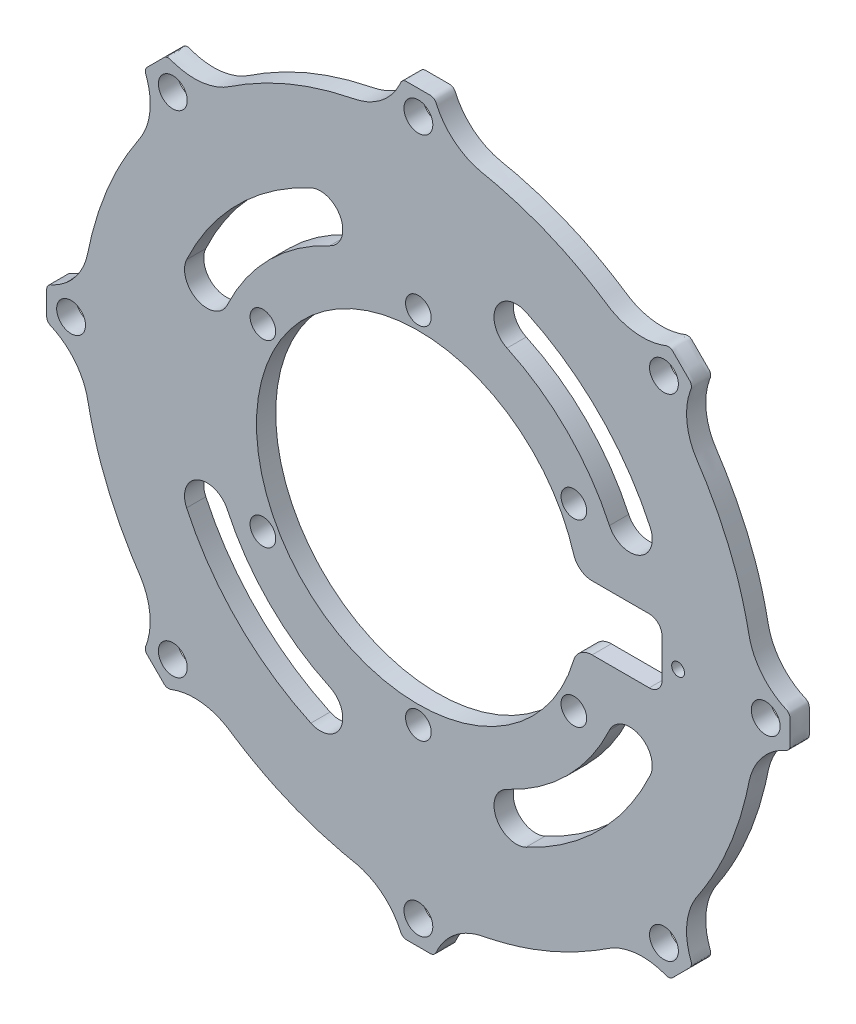
from build123d import *

# Parameters (mm, degrees)
SKETCH1_R                 = 1
BOSS_EXTRUDE1_DEPTH       = 3
F_4_0MM_DOWEL_HOLE1_D     = 4
F_4_0MM_DOWEL_HOLE1_DEPTH = 4
F_4_0MM_DOWEL_HOLE1_TIP   = 1.201721238
M4_CLEARANCE_HOLE1_D      = 4.5
M4_CLEARANCE_HOLE1_DEPTH  = 4
M4_CLEARANCE_HOLE1_TIP    = 1.351936393


with BuildPart() as part:
    # Sketch1 → Boss-Extrude1 (new body)
    with BuildSketch(Plane.XY):
        with BuildLine():
            add(Edge.make_bspline(
                [(-2.792588463, 57.296622314), (-2.798610234, 57.282848917), (-2.831786589, 57.2065726), (-2.866328079, 57.131672052), (-2.895249818, 57.070593275)],
                knots=[0.999327537, 0.999327537, 0.999327537, 0.999327537, 0.999448998, 1, 1, 1, 1], degree=3, weights=[1, 1, 1, 1, 1]))
            add(Edge.make_bspline(
                [(-2.895249818, 57.070593275), (-3.907352197, 54.933170755), (-5.586945631, 53.268270712), (-7.733178428, 52.274987752), (-8.218210626, 52.050513399), (-9.224266632, 51.679333443), (-10.81473369, 51.382377685), (-11.857368808, 51.146245707), (-12.376762361, 51.020248465), (-17.660128133, 49.738581586), (-22.682891966, 47.658084686), (-27.325071073, 44.828456262), (-27.781431281, 44.550283063), (-28.685656165, 43.979999224), (-30.020265638, 43.065348612), (-30.994118526, 42.616423452), (-31.495815419, 42.432181232), (-33.809504892, 41.582506281), (-36.274163076, 41.606308243), (-38.571011409, 42.500508575), (-38.571845248, 42.500833202), (-38.573512838, 42.50148268), (-38.57601405, 42.502457345), (-38.577681205, 42.503107942), (-38.578514782, 42.50343324), (-38.579346338, 42.50375775), (-38.581009449, 42.504406769), (-38.583504116, 42.505380297), (-38.585167228, 42.506029317), (-38.585998784, 42.506353826), (-38.590988118, 42.508300883), (-38.595977452, 42.510247941), (-38.600966787, 42.512194998), (-38.601798343, 42.512519508), (-38.603461454, 42.513168527), (-38.605956121, 42.514142055), (-38.607619233, 42.514791074), (-38.608450788, 42.515115584), (-38.60928525, 42.515441228), (-38.610954174, 42.516092515), (-38.613462374, 42.517057113), (-38.615135637, 42.517697174), (-38.615972697, 42.51801608), (-38.892469699, 42.623356827), (-39.187709119, 42.603838871), (-39.447932521, 42.463016124), (-39.476110803, 42.447767138), (-39.531001645, 42.414560688), (-39.611133429, 42.358611372), (-39.656444513, 42.313300288), (-39.679100055, 42.290644746), (-39.701755597, 42.267989204), (-39.747066681, 42.22267812), (-39.815033308, 42.154711493), (-39.860344392, 42.109400409), (-39.882999934, 42.086744867), (-40.617581578, 41.352163223), (-41.352163223, 40.617581578), (-42.086744867, 39.882999934), (-42.109400409, 39.860344392), (-42.154711493, 39.815033308), (-42.22267812, 39.747066681), (-42.267989204, 39.701755597), (-42.290644746, 39.679100055), (-42.313300288, 39.656444513), (-42.358611372, 39.611133429), (-42.414560688, 39.531001645), (-42.447767138, 39.476110803), (-42.463016124, 39.447932521), (-42.603838871, 39.187709119), (-42.623356827, 38.892469699), (-42.51801608, 38.615972697), (-42.517697174, 38.615135637), (-42.517057113, 38.613462374), (-42.516092515, 38.610954174), (-42.515441228, 38.60928525), (-42.515115584, 38.608450788), (-42.514791074, 38.607619233), (-42.514142055, 38.605956121), (-42.513168527, 38.603461454), (-42.512519508, 38.601798343), (-42.512194998, 38.600966787), (-42.510247941, 38.595977452), (-42.508300883, 38.590988118), (-42.506353826, 38.585998784), (-42.506029317, 38.585167228), (-42.505380297, 38.583504116), (-42.504406769, 38.581009449), (-42.50375775, 38.579346338), (-42.50343324, 38.578514782), (-42.503107942, 38.577681205), (-42.502457345, 38.57601405), (-42.50148268, 38.573512838), (-42.500833202, 38.571845248), (-42.500508575, 38.571011409), (-41.606308243, 36.274163076), (-41.582506281, 33.809504892), (-42.432181232, 31.495815419), (-42.616423452, 30.994118526), (-43.065348612, 30.020265638), (-43.979999224, 28.685656165), (-44.550283063, 27.781431281), (-44.828456262, 27.325071073), (-47.658084686, 22.682891966), (-49.738581586, 17.660128133), (-51.020248465, 12.376762361), (-51.146245707, 11.857368808), (-51.382377685, 10.81473369), (-51.679333443, 9.224266632), (-52.050513399, 8.218210626), (-52.274987752, 7.733178428), (-53.310202347, 5.496341992), (-55.069809391, 3.770396005), (-57.326221542, 2.778574093), (-57.327040701, 2.778214026), (-57.328679116, 2.777494111), (-57.331136932, 2.776414679), (-57.332775829, 2.775695865), (-57.333595278, 2.775336457), (-57.33441274, 2.774977922), (-57.336047663, 2.77426085), (-57.338500048, 2.773185243), (-57.340134971, 2.772468171), (-57.340952433, 2.772109635), (-57.345857202, 2.76995842), (-57.350761972, 2.767807206), (-57.355666742, 2.765655991), (-57.356484203, 2.765297455), (-57.358119126, 2.764580384), (-57.360571511, 2.763504776), (-57.362206434, 2.762787705), (-57.363023896, 2.762429169), (-57.363844214, 2.76206938), (-57.365484851, 2.761349803), (-57.367940491, 2.760258311), (-57.369576258, 2.759527727), (-57.370393649, 2.759161337), (-57.640393711, 2.638135588), (-57.835358227, 2.415568513), (-57.91978724, 2.131986062), (-57.928929633, 2.101278346), (-57.944262814, 2.038984153), (-57.961362401, 1.942760285), (-57.961362401, 1.878680735), (-57.961362401, 1.84664096), (-57.961362401, 1.814601185), (-57.961362401, 1.750521635), (-57.961362401, 1.654402311), (-57.961362401, 1.590322761), (-57.961362401, 1.558282986), (-57.961362401, 0.519427662), (-57.961362401, -0.519427662), (-57.961362401, -1.558282986), (-57.961362401, -1.590322761), (-57.961362401, -1.654402311), (-57.961362401, -1.750521635), (-57.961362401, -1.814601185), (-57.961362401, -1.84664096), (-57.961362401, -1.878680735), (-57.961362401, -1.942760285), (-57.944262814, -2.038984153), (-57.928929633, -2.101278346), (-57.91978724, -2.131986062), (-57.835358227, -2.415568513), (-57.640393711, -2.638135588), (-57.370393649, -2.759161337), (-57.369576258, -2.759527727), (-57.367940491, -2.760258311), (-57.365484851, -2.761349803), (-57.363844214, -2.76206938), (-57.363023896, -2.762429169), (-57.362206434, -2.762787705), (-57.360571511, -2.763504776), (-57.358119126, -2.764580384), (-57.356484203, -2.765297455), (-57.355666742, -2.765655991), (-57.350761972, -2.767807206), (-57.345857202, -2.76995842), (-57.340952433, -2.772109635), (-57.340134971, -2.772468171), (-57.338500048, -2.773185243), (-57.336047663, -2.77426085), (-57.33441274, -2.774977922), (-57.333595278, -2.775336457), (-57.332775829, -2.775695865), (-57.331136932, -2.776414679), (-57.328679116, -2.777494111), (-57.327040701, -2.778214026), (-57.326221542, -2.778574093), (-55.069809391, -3.770396005), (-53.310202347, -5.496341992), (-52.274987752, -7.733178428), (-52.050513399, -8.218210626), (-51.679333443, -9.224266632), (-51.382377685, -10.81473369), (-51.146245707, -11.857368808), (-51.020248465, -12.376762361), (-49.738581586, -17.660128133), (-47.658084686, -22.682891966), (-44.828456262, -27.325071073), (-44.550283063, -27.781431281), (-43.979999224, -28.685656165), (-43.065348612, -30.020265638), (-42.616423452, -30.994118526), (-42.432181232, -31.495815419), (-41.582506281, -33.809504892), (-41.606308243, -36.274163076), (-42.500508575, -38.571011409), (-42.500833202, -38.571845248), (-42.50148268, -38.573512838), (-42.502457345, -38.57601405), (-42.503107942, -38.577681205), (-42.50343324, -38.578514782), (-42.50375775, -38.579346338), (-42.504406769, -38.581009449), (-42.505380297, -38.583504116), (-42.506029317, -38.585167228), (-42.506353826, -38.585998784), (-42.508300883, -38.590988118), (-42.510247941, -38.595977452), (-42.512194998, -38.600966787), (-42.512519508, -38.601798343), (-42.513168527, -38.603461454), (-42.514142055, -38.605956121), (-42.514791074, -38.607619233), (-42.515115584, -38.608450788), (-42.515441228, -38.60928525), (-42.516092515, -38.610954174), (-42.517057113, -38.613462374), (-42.517697174, -38.615135637), (-42.51801608, -38.615972697), (-42.623356827, -38.892469699), (-42.603838871, -39.187709119), (-42.463016124, -39.447932521), (-42.447767138, -39.476110803), (-42.414560688, -39.531001645), (-42.358611372, -39.611133429), (-42.313300288, -39.656444513), (-42.290644746, -39.679100055), (-42.267989204, -39.701755597), (-42.22267812, -39.747066681), (-42.154711493, -39.815033308), (-42.109400409, -39.860344392), (-42.086744867, -39.882999934), (-41.352163223, -40.617581578), (-40.617581578, -41.352163223), (-39.882999934, -42.086744867), (-39.860344392, -42.109400409), (-39.815033308, -42.154711493), (-39.747066681, -42.22267812), (-39.701755597, -42.267989204), (-39.679100055, -42.290644746), (-39.656444513, -42.313300288), (-39.611133429, -42.358611372), (-39.531001645, -42.414560688), (-39.476110803, -42.447767138), (-39.447932521, -42.463016124), (-39.187709119, -42.603838871), (-38.892469699, -42.623356827), (-38.615972697, -42.51801608), (-38.615135637, -42.517697174), (-38.613462374, -42.517057113), (-38.610954174, -42.516092515), (-38.60928525, -42.515441228), (-38.608450788, -42.515115584), (-38.607619233, -42.514791074), (-38.605956121, -42.514142055), (-38.603461454, -42.513168527), (-38.601798343, -42.512519508), (-38.600966787, -42.512194998), (-38.595977452, -42.510247941), (-38.590988118, -42.508300883), (-38.585998784, -42.506353826), (-38.585167228, -42.506029317), (-38.583504116, -42.505380297), (-38.581009449, -42.504406769), (-38.579346338, -42.50375775), (-38.578514782, -42.50343324), (-38.577681205, -42.503107942), (-38.57601405, -42.502457345), (-38.573512838, -42.50148268), (-38.571845248, -42.500833202), (-38.571011409, -42.500508575), (-36.274163076, -41.606308243), (-33.809504892, -41.582506281), (-31.495815419, -42.432181232), (-30.994118526, -42.616423452), (-30.020265638, -43.065348612), (-28.685656165, -43.979999224), (-27.781431281, -44.550283063), (-27.325071073, -44.828456262), (-22.682891966, -47.658084686), (-17.660128133, -49.738581586), (-12.376762361, -51.020248465), (-11.857368808, -51.146245707), (-10.81473369, -51.382377685), (-9.224266632, -51.679333443), (-8.218210626, -52.050513399), (-7.733178428, -52.274987752), (-5.496341992, -53.310202347), (-3.770396005, -55.069809391), (-2.778574093, -57.326221542), (-2.778214026, -57.327040701), (-2.777494111, -57.328679116), (-2.776414679, -57.331136932), (-2.775695865, -57.332775829), (-2.775336457, -57.333595278), (-2.774977922, -57.33441274), (-2.77426085, -57.336047663), (-2.773185243, -57.338500048), (-2.772468171, -57.340134971), (-2.772109635, -57.340952433), (-2.76995842, -57.345857202), (-2.767807206, -57.350761972), (-2.765655991, -57.355666742), (-2.765297455, -57.356484203), (-2.764580384, -57.358119126), (-2.763504776, -57.360571511), (-2.762787705, -57.362206434), (-2.762429169, -57.363023896), (-2.76206938, -57.363844214), (-2.761349803, -57.365484851), (-2.760258311, -57.367940491), (-2.759527727, -57.369576258), (-2.759161337, -57.370393649), (-2.638135588, -57.640393711), (-2.415568513, -57.835358227), (-2.131986062, -57.91978724), (-2.101278346, -57.928929633), (-2.038984153, -57.944262814), (-1.942760285, -57.961362401), (-1.878680735, -57.961362401), (-1.84664096, -57.961362401), (-1.814601185, -57.961362401), (-1.750521635, -57.961362401), (-1.654402311, -57.961362401), (-1.590322761, -57.961362401), (-1.558282986, -57.961362401), (-0.519427662, -57.961362401), (0.519427662, -57.961362401), (1.558282986, -57.961362401), (1.590322761, -57.961362401), (1.654402311, -57.961362401), (1.750521635, -57.961362401), (1.814601185, -57.961362401), (1.84664096, -57.961362401), (1.878680735, -57.961362401), (1.942760285, -57.961362401), (2.038984153, -57.944262814), (2.101278346, -57.928929633), (2.131986062, -57.91978724), (2.415568513, -57.835358227), (2.638135588, -57.640393711), (2.759161337, -57.370393649), (2.759527727, -57.369576258), (2.760258311, -57.367940491), (2.761349803, -57.365484851), (2.76206938, -57.363844214), (2.762429169, -57.363023896), (2.762787705, -57.362206434), (2.763504776, -57.360571511), (2.764580384, -57.358119126), (2.765297455, -57.356484203), (2.765655991, -57.355666742), (2.767807206, -57.350761972), (2.76995842, -57.345857202), (2.772109635, -57.340952433), (2.772468171, -57.340134971), (2.773185243, -57.338500048), (2.77426085, -57.336047663), (2.774977922, -57.33441274), (2.775336457, -57.333595278), (2.775695865, -57.332775829), (2.776414679, -57.331136932), (2.777494111, -57.328679116), (2.778214026, -57.327040701), (2.778574093, -57.326221542), (3.770396005, -55.069809391), (5.496341992, -53.310202347), (7.733178428, -52.274987752), (8.218210626, -52.050513399), (9.224266632, -51.679333443), (10.81473369, -51.382377685), (11.857368808, -51.146245707), (12.376762361, -51.020248465), (17.660128133, -49.738581586), (22.682891966, -47.658084686), (27.325071073, -44.828456262), (27.781431281, -44.550283063), (28.685656165, -43.979999224), (30.020265638, -43.065348612), (30.994118526, -42.616423452), (31.495815419, -42.432181232), (33.809504892, -41.582506281), (36.274163076, -41.606308243), (38.571011409, -42.500508575), (38.571845248, -42.500833202), (38.573512838, -42.50148268), (38.57601405, -42.502457345), (38.577681205, -42.503107942), (38.578514782, -42.50343324), (38.579346338, -42.50375775), (38.581009449, -42.504406769), (38.583504116, -42.505380297), (38.585167228, -42.506029317), (38.585998784, -42.506353826), (38.590988118, -42.508300883), (38.595977452, -42.510247941), (38.600966787, -42.512194998), (38.601798343, -42.512519508), (38.603461454, -42.513168527), (38.605956121, -42.514142055), (38.607619233, -42.514791074), (38.608450788, -42.515115584), (38.60928525, -42.515441228), (38.610954174, -42.516092515), (38.613462374, -42.517057113), (38.615135637, -42.517697174), (38.615972697, -42.51801608), (38.892469699, -42.623356827), (39.187709119, -42.603838871), (39.447932521, -42.463016124), (39.476110803, -42.447767138), (39.531001645, -42.414560688), (39.611133429, -42.358611372), (39.656444513, -42.313300288), (39.679100055, -42.290644746), (39.701755597, -42.267989204), (39.747066681, -42.22267812), (39.815033308, -42.154711493), (39.860344392, -42.109400409), (39.882999934, -42.086744867), (40.617581578, -41.352163223), (41.352163223, -40.617581578), (42.086744867, -39.882999934), (42.109400409, -39.860344392), (42.154711493, -39.815033308), (42.22267812, -39.747066681), (42.267989204, -39.701755597), (42.290644746, -39.679100055), (42.313300288, -39.656444513), (42.358611372, -39.611133429), (42.414560688, -39.531001645), (42.447767138, -39.476110803), (42.463016124, -39.447932521), (42.603838871, -39.187709119), (42.623356827, -38.892469699), (42.51801608, -38.615972697), (42.517697174, -38.615135637), (42.517057113, -38.613462374), (42.516092515, -38.610954174), (42.515441228, -38.60928525), (42.515115584, -38.608450788), (42.514791074, -38.607619233), (42.514142055, -38.605956121), (42.513168527, -38.603461454), (42.512519508, -38.601798343), (42.512194998, -38.600966787), (42.510247941, -38.595977452), (42.508300883, -38.590988118), (42.506353826, -38.585998784), (42.506029317, -38.585167228), (42.505380297, -38.583504116), (42.504406769, -38.581009449), (42.50375775, -38.579346338), (42.50343324, -38.578514782), (42.503107942, -38.577681205), (42.502457345, -38.57601405), (42.50148268, -38.573512838), (42.500833202, -38.571845248), (42.500508575, -38.571011409), (41.606308243, -36.274163076), (41.582506281, -33.809504892), (42.432181232, -31.495815419), (42.616423452, -30.994118526), (43.065348612, -30.020265638), (43.979999224, -28.685656165), (44.550283063, -27.781431281), (44.828456262, -27.325071073), (47.658084686, -22.682891966), (49.738581586, -17.660128133), (51.020248465, -12.376762361), (51.146245707, -11.857368808), (51.382377685, -10.81473369), (51.679333443, -9.224266632), (52.050513399, -8.218210626), (52.274987752, -7.733178428), (53.310202347, -5.496341992), (55.069809391, -3.770396005), (57.326221542, -2.778574093), (57.327040701, -2.778214026), (57.328679116, -2.777494111), (57.331136932, -2.776414679), (57.332775829, -2.775695865), (57.333595278, -2.775336457), (57.33441274, -2.774977922), (57.336047663, -2.77426085), (57.338500048, -2.773185243), (57.340134971, -2.772468171), (57.340952433, -2.772109635), (57.345857202, -2.76995842), (57.350761972, -2.767807206), (57.355666742, -2.765655991), (57.356484203, -2.765297455), (57.358119126, -2.764580384), (57.360571511, -2.763504776), (57.362206434, -2.762787705), (57.363023896, -2.762429169), (57.363844214, -2.76206938), (57.365484851, -2.761349803), (57.367940491, -2.760258311), (57.369576258, -2.759527727), (57.370393649, -2.759161337), (57.640393711, -2.638135588), (57.835358227, -2.415568513), (57.91978724, -2.131986062), (57.928929633, -2.101278346), (57.944262814, -2.038984153), (57.961362401, -1.942760285), (57.961362401, -1.878680735), (57.961362401, -1.84664096), (57.961362401, -1.814601185), (57.961362401, -1.750521635), (57.961362401, -1.654402311), (57.961362401, -1.590322761), (57.961362401, -1.558282986), (57.961362401, -0.519427662), (57.961362401, 0.519427662), (57.961362401, 1.558282986), (57.961362401, 1.590322761), (57.961362401, 1.654402311), (57.961362401, 1.750521635), (57.961362401, 1.814601185), (57.961362401, 1.84664096), (57.961362401, 1.878680735), (57.961362401, 1.942760285), (57.944262814, 2.038984153), (57.928929633, 2.101278346), (57.91978724, 2.131986062), (57.835358227, 2.415568513), (57.640393711, 2.638135588), (57.370393649, 2.759161337), (57.369576258, 2.759527727), (57.367940491, 2.760258311), (57.365484851, 2.761349803), (57.363844214, 2.76206938), (57.363023896, 2.762429169), (57.362206434, 2.762787705), (57.360571511, 2.763504776), (57.358119126, 2.764580384), (57.356484203, 2.765297455), (57.355666742, 2.765655991), (57.350761972, 2.767807206), (57.345857202, 2.76995842), (57.340952433, 2.772109635), (57.340134971, 2.772468171), (57.338500048, 2.773185243), (57.336047663, 2.77426085), (57.33441274, 2.774977922), (57.333595278, 2.775336457), (57.332775829, 2.775695865), (57.331136932, 2.776414679), (57.328679116, 2.777494111), (57.327040701, 2.778214026), (57.326221542, 2.778574093), (55.069809391, 3.770396005), (53.310202347, 5.496341992), (52.274987752, 7.733178428), (52.050513399, 8.218210626), (51.679333443, 9.224266632), (51.382377685, 10.81473369), (51.146245707, 11.857368808), (51.020248465, 12.376762361), (49.738581586, 17.660128133), (47.658084686, 22.682891966), (44.828456262, 27.325071073), (44.550283063, 27.781431281), (43.979999224, 28.685656165), (43.065348612, 30.020265638), (42.616423452, 30.994118526), (42.432181232, 31.495815419), (41.582506281, 33.809504892), (41.606308243, 36.274163076), (42.500508575, 38.571011409), (42.500833202, 38.571845248), (42.50148268, 38.573512838), (42.502457345, 38.57601405), (42.503107942, 38.577681205), (42.50343324, 38.578514782), (42.50375775, 38.579346338), (42.504406769, 38.581009449), (42.505380297, 38.583504116), (42.506029317, 38.585167228), (42.506353826, 38.585998784), (42.508300883, 38.590988118), (42.510247941, 38.595977452), (42.512194998, 38.600966787), (42.512519508, 38.601798343), (42.513168527, 38.603461454), (42.514142055, 38.605956121), (42.514791074, 38.607619233), (42.515115584, 38.608450788), (42.515441228, 38.60928525), (42.516092515, 38.610954174), (42.517057113, 38.613462374), (42.517697174, 38.615135637), (42.51801608, 38.615972697), (42.623356827, 38.892469699), (42.603838871, 39.187709119), (42.463016124, 39.447932521), (42.447767138, 39.476110803), (42.414560688, 39.531001645), (42.358611372, 39.611133429), (42.313300288, 39.656444513), (42.290644746, 39.679100055), (42.267989204, 39.701755597), (42.22267812, 39.747066681), (42.154711493, 39.815033308), (42.109400409, 39.860344392), (42.086744867, 39.882999934), (41.352163223, 40.617581578), (40.617581578, 41.352163223), (39.882999934, 42.086744867), (39.860344392, 42.109400409), (39.815033308, 42.154711493), (39.747066681, 42.22267812), (39.701755597, 42.267989204), (39.679100055, 42.290644746), (39.656444513, 42.313300288), (39.611133429, 42.358611372), (39.531001645, 42.414560688), (39.476110803, 42.447767138), (39.447932521, 42.463016124), (39.187709119, 42.603838871), (38.892469699, 42.623356827), (38.615972697, 42.51801608), (38.615135637, 42.517697174), (38.613462374, 42.517057113), (38.610954174, 42.516092515), (38.60928525, 42.515441228), (38.608450788, 42.515115584), (38.607619233, 42.514791074), (38.605956121, 42.514142055), (38.603461454, 42.513168527), (38.601798343, 42.512519508), (38.600966787, 42.512194998), (38.595977452, 42.510247941), (38.590988118, 42.508300883), (38.585998784, 42.506353826), (38.585167228, 42.506029317), (38.583504116, 42.505380297), (38.581009449, 42.504406769), (38.579346338, 42.50375775), (38.578514782, 42.50343324), (38.577681205, 42.503107942), (38.57601405, 42.502457345), (38.573512838, 42.50148268), (38.571845248, 42.500833202), (38.571011409, 42.500508575), (36.274163076, 41.606308243), (33.809504892, 41.582506281), (31.495815419, 42.432181232), (30.994118526, 42.616423452), (30.020265638, 43.065348612), (28.685656165, 43.979999224), (27.781431281, 44.550283063), (27.325071073, 44.828456262), (22.682891966, 47.658084686), (17.660128133, 49.738581586), (12.376762361, 51.020248465), (11.857368808, 51.146245707), (10.81473369, 51.382377685), (9.224266632, 51.679333443), (8.218210626, 52.050513399), (7.733178428, 52.274987752), (5.586945631, 53.268270712), (3.907352197, 54.933170755), (2.895249818, 57.070593275), (2.866328079, 57.131672052), (2.809722916, 57.254415967), (2.730314338, 57.444073844), (2.653418588, 57.556069844), (2.609742987, 57.607640434), (2.483296792, 57.756943586), (2.319504695, 57.863958634), (2.131986062, 57.91978724), (2.101278346, 57.928929633), (2.038984153, 57.944262814), (1.942760285, 57.961362401), (1.878680735, 57.961362401), (1.84664096, 57.961362401), (1.814601185, 57.961362401), (1.750521635, 57.961362401), (1.654402311, 57.961362401), (1.590322761, 57.961362401), (1.558282986, 57.961362401), (0.519427662, 57.961362401), (-0.519427662, 57.961362401), (-1.558282986, 57.961362401), (-1.590322761, 57.961362401), (-1.654402311, 57.961362401), (-1.750521635, 57.961362401), (-1.814601185, 57.961362401), (-1.84664096, 57.961362401), (-1.878680735, 57.961362401), (-1.942760285, 57.961362401), (-2.038984153, 57.944262814), (-2.101278346, 57.928929633), (-2.131986062, 57.91978724), (-2.319504695, 57.863958634), (-2.483296792, 57.756943586), (-2.609742987, 57.607640434), (-2.653418588, 57.556069844), (-2.721839041, 57.456417821), (-2.77129269, 57.34533143), (-2.792588463, 57.296622314)],
                knots=[0, 0, 0, 0, 0.018513449, 0.018513449, 0.018513449, 0.022871046, 0.027228642, 0.031586239, 0.031586239, 0.031586239, 0.075559554, 0.075559554, 0.075559554, 0.079917151, 0.084274748, 0.088632345, 0.088632345, 0.088632345, 0.107861988, 0.107861988, 0.107861988, 0.107869283, 0.107876579, 0.107883874, 0.107883874, 0.107883874, 0.107891152, 0.10789843, 0.107905708, 0.107905708, 0.107905708, 0.107949375, 0.107949375, 0.107949375, 0.107956653, 0.107963931, 0.107971209, 0.107971209, 0.107971209, 0.107978512, 0.107985816, 0.107993119, 0.107993119, 0.107993119, 0.110259129, 0.110259129, 0.110259129, 0.110520359, 0.110781589, 0.111042819, 0.111042819, 0.111042819, 0.111304049, 0.11156528, 0.11182651, 0.11182651, 0.11182651, 0.120296615, 0.120296615, 0.120296615, 0.120557845, 0.120819075, 0.121080305, 0.121080305, 0.121080305, 0.121341536, 0.121602766, 0.121863996, 0.121863996, 0.121863996, 0.124130006, 0.124130006, 0.124130006, 0.124137309, 0.124144612, 0.124151916, 0.124151916, 0.124151916, 0.124159193, 0.124166471, 0.124173749, 0.124173749, 0.124173749, 0.124217417, 0.124217417, 0.124217417, 0.124224695, 0.124231972, 0.12423925, 0.12423925, 0.12423925, 0.124246546, 0.124253842, 0.124261137, 0.124261137, 0.124261137, 0.14349078, 0.14349078, 0.14349078, 0.147848377, 0.152205974, 0.15656357, 0.15656357, 0.15656357, 0.200536886, 0.200536886, 0.200536886, 0.204894482, 0.209252079, 0.213609676, 0.213609676, 0.213609676, 0.232839319, 0.232839319, 0.232839319, 0.232846615, 0.23285391, 0.232861206, 0.232861206, 0.232861206, 0.232868484, 0.232875762, 0.232883039, 0.232883039, 0.232883039, 0.232926707, 0.232926707, 0.232926707, 0.232933985, 0.232941263, 0.232948541, 0.232948541, 0.232948541, 0.232955844, 0.232963147, 0.232970451, 0.232970451, 0.232970451, 0.23523646, 0.23523646, 0.23523646, 0.23549769, 0.235758921, 0.236020151, 0.236020151, 0.236020151, 0.236281381, 0.236542611, 0.236803841, 0.236803841, 0.236803841, 0.245273946, 0.245273946, 0.245273946, 0.245535177, 0.245796407, 0.246057637, 0.246057637, 0.246057637, 0.246318867, 0.246580097, 0.246841327, 0.246841327, 0.246841327, 0.249107337, 0.249107337, 0.249107337, 0.24911464, 0.249121944, 0.249129247, 0.249129247, 0.249129247, 0.249136525, 0.249143803, 0.249151081, 0.249151081, 0.249151081, 0.249194748, 0.249194748, 0.249194748, 0.249202026, 0.249209304, 0.249216582, 0.249216582, 0.249216582, 0.249223877, 0.249231173, 0.249238469, 0.249238469, 0.249238469, 0.268468112, 0.268468112, 0.268468112, 0.272825708, 0.277183305, 0.281540902, 0.281540902, 0.281540902, 0.325514217, 0.325514217, 0.325514217, 0.329871814, 0.334229411, 0.338587007, 0.338587007, 0.338587007, 0.35781665, 0.35781665, 0.35781665, 0.357823946, 0.357831241, 0.357838537, 0.357838537, 0.357838537, 0.357845815, 0.357853093, 0.357860371, 0.357860371, 0.357860371, 0.357904038, 0.357904038, 0.357904038, 0.357911316, 0.357918594, 0.357925872, 0.357925872, 0.357925872, 0.357933175, 0.357940479, 0.357947782, 0.357947782, 0.357947782, 0.360213792, 0.360213792, 0.360213792, 0.360475022, 0.360736252, 0.360997482, 0.360997482, 0.360997482, 0.361258712, 0.361519942, 0.361781172, 0.361781172, 0.361781172, 0.370251278, 0.370251278, 0.370251278, 0.370512508, 0.370773738, 0.371034968, 0.371034968, 0.371034968, 0.371296198, 0.371557428, 0.371818658, 0.371818658, 0.371818658, 0.374084668, 0.374084668, 0.374084668, 0.374091972, 0.374099275, 0.374106578, 0.374106578, 0.374106578, 0.374113856, 0.374121134, 0.374128412, 0.374128412, 0.374128412, 0.374172079, 0.374172079, 0.374172079, 0.374179357, 0.374186635, 0.374193913, 0.374193913, 0.374193913, 0.374201209, 0.374208504, 0.3742158, 0.3742158, 0.3742158, 0.393445443, 0.393445443, 0.393445443, 0.39780304, 0.402160636, 0.406518233, 0.406518233, 0.406518233, 0.450491548, 0.450491548, 0.450491548, 0.454849145, 0.459206742, 0.463564339, 0.463564339, 0.463564339, 0.482793982, 0.482793982, 0.482793982, 0.482801277, 0.482808573, 0.482815868, 0.482815868, 0.482815868, 0.482823146, 0.482830424, 0.482837702, 0.482837702, 0.482837702, 0.482881369, 0.482881369, 0.482881369, 0.482888647, 0.482895925, 0.482903203, 0.482903203, 0.482903203, 0.482910507, 0.48291781, 0.482925113, 0.482925113, 0.482925113, 0.485191123, 0.485191123, 0.485191123, 0.485452353, 0.485713583, 0.485974813, 0.485974813, 0.485974813, 0.486236043, 0.486497274, 0.486758504, 0.486758504, 0.486758504, 0.495228609, 0.495228609, 0.495228609, 0.495489839, 0.495751069, 0.496012299, 0.496012299, 0.496012299, 0.49627353, 0.49653476, 0.49679599, 0.49679599, 0.49679599, 0.499062, 0.499062, 0.499062, 0.499069303, 0.499076606, 0.49908391, 0.49908391, 0.49908391, 0.499091188, 0.499098465, 0.499105743, 0.499105743, 0.499105743, 0.499149411, 0.499149411, 0.499149411, 0.499156689, 0.499163967, 0.499171244, 0.499171244, 0.499171244, 0.49917854, 0.499185836, 0.499193131, 0.499193131, 0.499193131, 0.518422774, 0.518422774, 0.518422774, 0.522780371, 0.527137968, 0.531495564, 0.531495564, 0.531495564, 0.57546888, 0.57546888, 0.57546888, 0.579826476, 0.584184073, 0.58854167, 0.58854167, 0.58854167, 0.607771313, 0.607771313, 0.607771313, 0.607778609, 0.607785904, 0.6077932, 0.6077932, 0.6077932, 0.607800478, 0.607807756, 0.607815033, 0.607815033, 0.607815033, 0.607858701, 0.607858701, 0.607858701, 0.607865979, 0.607873257, 0.607880535, 0.607880535, 0.607880535, 0.607887838, 0.607895141, 0.607902445, 0.607902445, 0.607902445, 0.610168454, 0.610168454, 0.610168454, 0.610429685, 0.610690915, 0.610952145, 0.610952145, 0.610952145, 0.611213375, 0.611474605, 0.611735835, 0.611735835, 0.611735835, 0.620205941, 0.620205941, 0.620205941, 0.620467171, 0.620728401, 0.620989631, 0.620989631, 0.620989631, 0.621250861, 0.621512091, 0.621773321, 0.621773321, 0.621773321, 0.624039331, 0.624039331, 0.624039331, 0.624046634, 0.624053938, 0.624061241, 0.624061241, 0.624061241, 0.624068519, 0.624075797, 0.624083075, 0.624083075, 0.624083075, 0.624126742, 0.624126742, 0.624126742, 0.62413402, 0.624141298, 0.624148576, 0.624148576, 0.624148576, 0.624155871, 0.624163167, 0.624170463, 0.624170463, 0.624170463, 0.643400106, 0.643400106, 0.643400106, 0.647757702, 0.652115299, 0.656472896, 0.656472896, 0.656472896, 0.700446211, 0.700446211, 0.700446211, 0.704803808, 0.709161405, 0.713519001, 0.713519001, 0.713519001, 0.732748644, 0.732748644, 0.732748644, 0.73275594, 0.732763236, 0.732770531, 0.732770531, 0.732770531, 0.732777809, 0.732785087, 0.732792365, 0.732792365, 0.732792365, 0.732836032, 0.732836032, 0.732836032, 0.73284331, 0.732850588, 0.732857866, 0.732857866, 0.732857866, 0.732865169, 0.732872473, 0.732879776, 0.732879776, 0.732879776, 0.735145786, 0.735145786, 0.735145786, 0.735407016, 0.735668246, 0.735929476, 0.735929476, 0.735929476, 0.736190706, 0.736451936, 0.736713166, 0.736713166, 0.736713166, 0.745183272, 0.745183272, 0.745183272, 0.745444502, 0.745705732, 0.745966962, 0.745966962, 0.745966962, 0.746228192, 0.746489422, 0.746750652, 0.746750652, 0.746750652, 0.749016662, 0.749016662, 0.749016662, 0.749023966, 0.749031269, 0.749038572, 0.749038572, 0.749038572, 0.74904585, 0.749053128, 0.749060406, 0.749060406, 0.749060406, 0.749104073, 0.749104073, 0.749104073, 0.749111351, 0.749118629, 0.749125907, 0.749125907, 0.749125907, 0.749133203, 0.749140498, 0.749147794, 0.749147794, 0.749147794, 0.768377437, 0.768377437, 0.768377437, 0.772735034, 0.77709263, 0.781450227, 0.781450227, 0.781450227, 0.825423542, 0.825423542, 0.825423542, 0.829781139, 0.834138736, 0.838496333, 0.838496333, 0.838496333, 0.857725976, 0.857725976, 0.857725976, 0.857733271, 0.857740567, 0.857747862, 0.857747862, 0.857747862, 0.85775514, 0.857762418, 0.857769696, 0.857769696, 0.857769696, 0.857813364, 0.857813364, 0.857813364, 0.857820641, 0.857827919, 0.857835197, 0.857835197, 0.857835197, 0.857842501, 0.857849804, 0.857857107, 0.857857107, 0.857857107, 0.860123117, 0.860123117, 0.860123117, 0.860384347, 0.860645577, 0.860906807, 0.860906807, 0.860906807, 0.861168037, 0.861429268, 0.861690498, 0.861690498, 0.861690498, 0.870160603, 0.870160603, 0.870160603, 0.870421833, 0.870683063, 0.870944293, 0.870944293, 0.870944293, 0.871205524, 0.871466754, 0.871727984, 0.871727984, 0.871727984, 0.873993994, 0.873993994, 0.873993994, 0.874001297, 0.8740086, 0.874015904, 0.874015904, 0.874015904, 0.874023182, 0.874030459, 0.874037737, 0.874037737, 0.874037737, 0.874081405, 0.874081405, 0.874081405, 0.874088683, 0.874095961, 0.874103238, 0.874103238, 0.874103238, 0.874110534, 0.87411783, 0.874125125, 0.874125125, 0.874125125, 0.893354768, 0.893354768, 0.893354768, 0.897712365, 0.902069962, 0.906427559, 0.906427559, 0.906427559, 0.950400874, 0.950400874, 0.950400874, 0.95475847, 0.959116067, 0.963473664, 0.963473664, 0.963473664, 0.981987113, 0.981987113, 0.981987113, 0.982538115, 0.983089117, 0.983640119, 0.983640119, 0.983640119, 0.985191123, 0.985191123, 0.985191123, 0.985452353, 0.985713583, 0.985974813, 0.985974813, 0.985974813, 0.986236043, 0.986497274, 0.986758504, 0.986758504, 0.986758504, 0.995228609, 0.995228609, 0.995228609, 0.995489839, 0.995751069, 0.996012299, 0.996012299, 0.996012299, 0.99627353, 0.99653476, 0.99679599, 0.99679599, 0.99679599, 0.998346994, 0.998346994, 0.998346994, 0.998897996, 0.999327537, 0.999327537, 0.999327537, 0.999327537], degree=3, weights=[1, 0.960138827, 0.960138827, 1, 1, 1, 1, 1, 1, 0.992037399, 0.992037399, 1, 1, 1, 1, 1, 1, 0.956886711, 0.956886711, 1, 1, 1, 1, 1, 1, 1, 1, 1, 1, 1, 1, 1, 1, 1, 1, 1, 1, 1, 1, 1, 1, 1, 1, 0.939305267, 0.939305267, 1, 1, 1, 1, 1, 1, 1, 1, 1, 1, 1, 1, 1, 1, 1, 1, 1, 1, 1, 1, 1, 1, 1, 1, 0.939305267, 0.939305267, 1, 1, 1, 1, 1, 1, 1, 1, 1, 1, 1, 1, 1, 1, 1, 1, 1, 1, 1, 1, 1, 1, 1, 1, 0.956886711, 0.956886711, 1, 1, 1, 1, 1, 1, 0.992037399, 0.992037399, 1, 1, 1, 1, 1, 1, 0.956886711, 0.956886711, 1, 1, 1, 1, 1, 1, 1, 1, 1, 1, 1, 1, 1, 1, 1, 1, 1, 1, 1, 1, 1, 1, 1, 1, 0.939305267, 0.939305267, 1, 1, 1, 1, 1, 1, 1, 1, 1, 1, 1, 1, 1, 1, 1, 1, 1, 1, 1, 1, 1, 1, 1, 1, 0.939305267, 0.939305267, 1, 1, 1, 1, 1, 1, 1, 1, 1, 1, 1, 1, 1, 1, 1, 1, 1, 1, 1, 1, 1, 1, 1, 1, 0.956886711, 0.956886711, 1, 1, 1, 1, 1, 1, 0.992037399, 0.992037399, 1, 1, 1, 1, 1, 1, 0.956886711, 0.956886711, 1, 1, 1, 1, 1, 1, 1, 1, 1, 1, 1, 1, 1, 1, 1, 1, 1, 1, 1, 1, 1, 1, 1, 1, 0.939305267, 0.939305267, 1, 1, 1, 1, 1, 1, 1, 1, 1, 1, 1, 1, 1, 1, 1, 1, 1, 1, 1, 1, 1, 1, 1, 1, 0.939305267, 0.939305267, 1, 1, 1, 1, 1, 1, 1, 1, 1, 1, 1, 1, 1, 1, 1, 1, 1, 1, 1, 1, 1, 1, 1, 1, 0.956886711, 0.956886711, 1, 1, 1, 1, 1, 1, 0.992037399, 0.992037399, 1, 1, 1, 1, 1, 1, 0.956886711, 0.956886711, 1, 1, 1, 1, 1, 1, 1, 1, 1, 1, 1, 1, 1, 1, 1, 1, 1, 1, 1, 1, 1, 1, 1, 1, 0.939305267, 0.939305267, 1, 1, 1, 1, 1, 1, 1, 1, 1, 1, 1, 1, 1, 1, 1, 1, 1, 1, 1, 1, 1, 1, 1, 1, 0.939305267, 0.939305267, 1, 1, 1, 1, 1, 1, 1, 1, 1, 1, 1, 1, 1, 1, 1, 1, 1, 1, 1, 1, 1, 1, 1, 1, 0.956886711, 0.956886711, 1, 1, 1, 1, 1, 1, 0.992037399, 0.992037399, 1, 1, 1, 1, 1, 1, 0.956886711, 0.956886711, 1, 1, 1, 1, 1, 1, 1, 1, 1, 1, 1, 1, 1, 1, 1, 1, 1, 1, 1, 1, 1, 1, 1, 1, 0.939305267, 0.939305267, 1, 1, 1, 1, 1, 1, 1, 1, 1, 1, 1, 1, 1, 1, 1, 1, 1, 1, 1, 1, 1, 1, 1, 1, 0.939305267, 0.939305267, 1, 1, 1, 1, 1, 1, 1, 1, 1, 1, 1, 1, 1, 1, 1, 1, 1, 1, 1, 1, 1, 1, 1, 1, 0.956886711, 0.956886711, 1, 1, 1, 1, 1, 1, 0.992037399, 0.992037399, 1, 1, 1, 1, 1, 1, 0.956886711, 0.956886711, 1, 1, 1, 1, 1, 1, 1, 1, 1, 1, 1, 1, 1, 1, 1, 1, 1, 1, 1, 1, 1, 1, 1, 1, 0.939305267, 0.939305267, 1, 1, 1, 1, 1, 1, 1, 1, 1, 1, 1, 1, 1, 1, 1, 1, 1, 1, 1, 1, 1, 1, 1, 1, 0.939305267, 0.939305267, 1, 1, 1, 1, 1, 1, 1, 1, 1, 1, 1, 1, 1, 1, 1, 1, 1, 1, 1, 1, 1, 1, 1, 1, 0.956886711, 0.956886711, 1, 1, 1, 1, 1, 1, 0.992037399, 0.992037399, 1, 1, 1, 1, 1, 1, 0.956886711, 0.956886711, 1, 1, 1, 1, 1, 1, 1, 1, 1, 1, 1, 1, 1, 1, 1, 1, 1, 1, 1, 1, 1, 1, 1, 1, 0.939305267, 0.939305267, 1, 1, 1, 1, 1, 1, 1, 1, 1, 1, 1, 1, 1, 1, 1, 1, 1, 1, 1, 1, 1, 1, 1, 1, 0.939305267, 0.939305267, 1, 1, 1, 1, 1, 1, 1, 1, 1, 1, 1, 1, 1, 1, 1, 1, 1, 1, 1, 1, 1, 1, 1, 1, 0.956886711, 0.956886711, 1, 1, 1, 1, 1, 1, 0.992037399, 0.992037399, 1, 1, 1, 1, 1, 1, 0.960138827, 0.960138827, 1, 1, 1, 1, 1, 1, 0.972283226, 0.972283226, 1, 1, 1, 1, 1, 1, 1, 1, 1, 1, 1, 1, 1, 1, 1, 1, 1, 1, 1, 1, 1, 1, 1, 1, 0.972283226, 0.972283226, 1, 1, 1, 1, 1]))
        make_face()
        with BuildLine():
            ThreePointArc((-16.766354404, -36.146345677), (-28.175068286, -28.175068286), (-36.146345677, -16.766354404))
            ThreePointArc((-36.146345677, -16.766354404), (-34.444023934, -12.118548397), (-29.796217927, -13.82087014))
            ThreePointArc((-29.796217927, -13.82087014), (-23.225320818, -23.225320818), (-13.82087014, -29.796217927))
            ThreePointArc((-13.82087014, -29.796217927), (-12.118548397, -34.444023934), (-16.766354404, -36.146345677))
        make_face(mode=Mode.SUBTRACT)
        with BuildLine():
            ThreePointArc((36.146345677, -16.766354404), (28.175068286, -28.175068286), (16.766354404, -36.146345677))
            ThreePointArc((16.766354404, -36.146345677), (12.118548397, -34.444023934), (13.82087014, -29.796217927))
            ThreePointArc((13.82087014, -29.796217927), (23.225320818, -23.225320818), (29.796217927, -13.82087014))
            ThreePointArc((29.796217927, -13.82087014), (34.444023934, -12.118548397), (36.146345677, -16.766354404))
        make_face(mode=Mode.SUBTRACT)
        with Locations((40.499304298, -0.237384428)):
            Circle(SKETCH1_R, mode=Mode.SUBTRACT)
        with BuildLine():
            ThreePointArc((-36.146345677, 16.766354404), (-28.175068286, 28.175068286), (-16.766354404, 36.146345677))
            ThreePointArc((-16.766354404, 36.146345677), (-12.118548397, 34.444023934), (-13.82087014, 29.796217927))
            ThreePointArc((-13.82087014, 29.796217927), (-23.225320818, 23.225320818), (-29.796217927, 13.82087014))
            ThreePointArc((-29.796217927, 13.82087014), (-34.444023934, 12.118548397), (-36.146345677, 16.766354404))
        make_face(mode=Mode.SUBTRACT)
        with BuildLine():
            Line((38, 3), (38, -3))
            ThreePointArc((38, -3), (37.414213562, -4.414213562), (36, -5))
            Line((36, -5), (27.093587802, -5))
            ThreePointArc((27.093587802, -5), (25.297574518, -5.59701513), (24.216392637, -7.150442478))
            ThreePointArc((24.216392637, -7.150442478), (-25.25, 0), (24.216392637, 7.150442478))
            ThreePointArc((24.216392637, 7.150442478), (25.297574518, 5.59701513), (27.093587802, 5))
            Line((27.093587802, 5), (36, 5))
            ThreePointArc((36, 5), (37.414213562, 4.414213562), (38, 3))
        make_face(mode=Mode.SUBTRACT)
        with BuildLine():
            ThreePointArc((16.766354404, 36.146345677), (28.175068286, 28.175068286), (36.146345677, 16.766354404))
            ThreePointArc((36.146345677, 16.766354404), (34.444023934, 12.118548397), (29.796217927, 13.82087014))
            ThreePointArc((29.796217927, 13.82087014), (23.225320818, 23.225320818), (13.82087014, 29.796217927))
            ThreePointArc((13.82087014, 29.796217927), (12.118548397, 34.444023934), (16.766354404, 36.146345677))
        make_face(mode=Mode.SUBTRACT)
    extrude(amount=BOSS_EXTRUDE1_DEPTH)

    # Ø4.0mm Dowel Hole1
    with Locations(Plane.XY.offset(3)):
        with Locations((0, 28), (24.248711306, 14), (24.248711306, -14), (0, -28), (-24.248711306, -14), (-24.248711306, 14)):
            Hole(F_4_0MM_DOWEL_HOLE1_D / 2, depth=F_4_0MM_DOWEL_HOLE1_DEPTH)
            with Locations((0, 0, -(F_4_0MM_DOWEL_HOLE1_DEPTH + F_4_0MM_DOWEL_HOLE1_TIP / 2))):  # 118° drill point
                Cone(0, F_4_0MM_DOWEL_HOLE1_D / 2, F_4_0MM_DOWEL_HOLE1_TIP, mode=Mode.SUBTRACT)

    # M4 Clearance Hole1
    with Locations(Plane.XY.offset(3)):
        with Locations((0, 54.161362401), (-38.297866632, 38.297866632), (38.297866632, 38.297866632), (54.161362401, 0), (38.297866632, -38.297866632), (-54.161362401, 0), (-38.297866632, -38.297866632), (0, -54.161362401)):
            Hole(M4_CLEARANCE_HOLE1_D / 2, depth=M4_CLEARANCE_HOLE1_DEPTH)
            with Locations((0, 0, -(M4_CLEARANCE_HOLE1_DEPTH + M4_CLEARANCE_HOLE1_TIP / 2))):  # 118° drill point
                Cone(0, M4_CLEARANCE_HOLE1_D / 2, M4_CLEARANCE_HOLE1_TIP, mode=Mode.SUBTRACT)


solid = part.part
